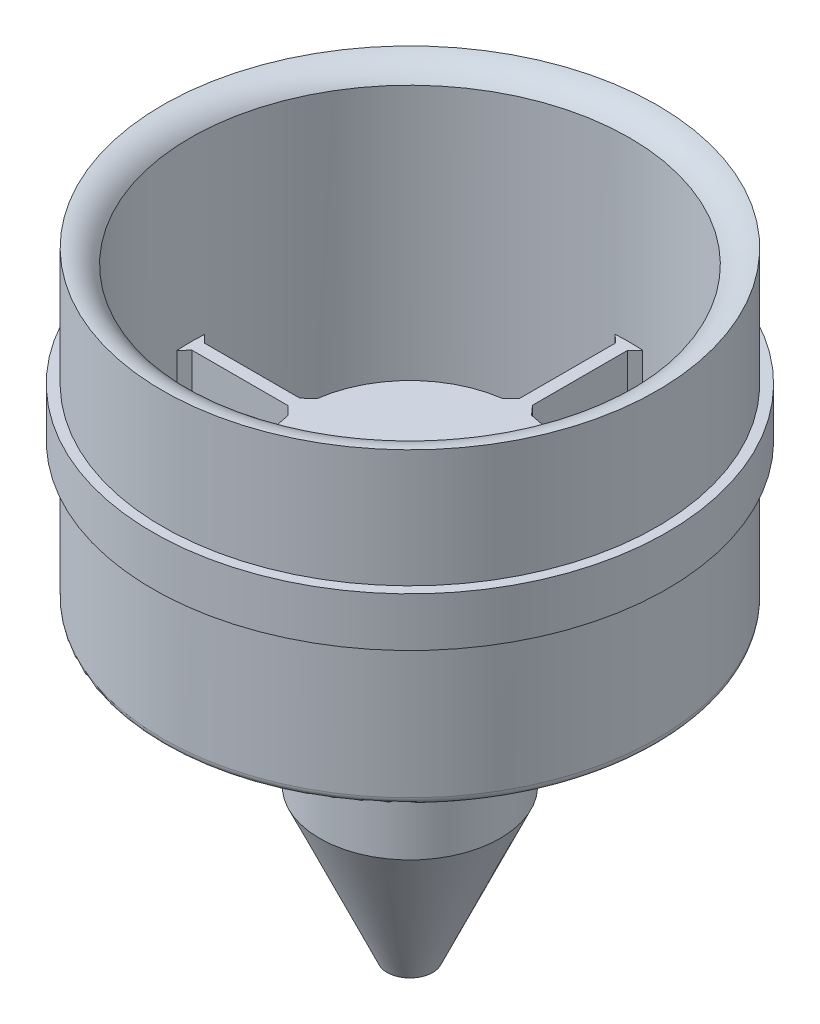
from build123d import *

# Parameters (mm, degrees)
SKETCH1_R           = 40
SKETCH1_R_2         = 35.5
BOSS_EXTRUDE1_DEPTH = 50
BOSS_EXTRUDE2_DEPTH = 19.05
SKETCH4_R           = 3.175
CUT_EXTRUDE1_DEPTH  = 6.35
CHAMFER1_SIZE       = 1.27
CHAMFER1_SIZE2      = 2.532115863
CHAMFER2_SIZE       = 1.27
CHAMFER2_SIZE_2     = 1.349308072
CHAMFER2_SIZE_3     = 1.235682395
CHAMFER3_SIZE       = 1.27
FILLET1_R           = 1.27
SKETCH9_W           = 1.5875
SKETCH9_H           = 7.9375


with BuildPart() as part:
    # Sketch1 → Boss-Extrude1 (new body)
    with BuildSketch(Plane(origin=(0, 0, 0), x_dir=(1, 0, 0), z_dir=(0, 1, 0))):
        with Locations(Location((0, 0, 0), (0, 0, 270))):
            Circle(SKETCH1_R)
        with Locations(Location((0, 0, 0), (0, 0, 270))):
            Circle(SKETCH1_R_2, mode=Mode.SUBTRACT)
    extrude(amount=BOSS_EXTRUDE1_DEPTH)

    # Sketch3 → Boss-Extrude2 (add)
    with BuildSketch(Plane.XZ):
        with BuildLine():
            Line((17.47140521, -1), (1, -1))
            Line((1, -1), (1, -17.47140521))
            ThreePointArc((1, -17.47140521), (12.374368671, -12.374368671), (17.47140521, -1))
        make_face()
        with BuildLine():
            Line((1, 17.47140521), (1, 1))
            Line((1, 1), (17.47140521, 1))
            ThreePointArc((17.47140521, 1), (12.374368671, 12.374368671), (1, 17.47140521))
        make_face()
        with BuildLine():
            Line((-17.47140521, 1), (-1, 1))
            Line((-1, 1), (-1, 17.47140521))
            ThreePointArc((-1, 17.47140521), (-12.374368671, 12.374368671), (-17.47140521, 1))
        make_face()
        with BuildLine():
            Line((-1, -17.47140521), (-1, -1))
            Line((-1, -1), (-17.47140521, -1))
            ThreePointArc((-17.47140521, -1), (-12.374368671, -12.374368671), (-1, -17.47140521))
        make_face()
        with BuildLine():
            ThreePointArc((0, -1), (0.707106781, -0.707106781), (1, 0))
            ThreePointArc((1, 0), (0.707106781, 0.707106781), (0, 1))
            ThreePointArc((0, 1), (-0.707106781, 0.707106781), (-1, 0))
            ThreePointArc((-1, 0), (-0.707106781, -0.707106781), (0, -1))
        make_face()
        with BuildLine():
            Line((-1, -1), (0, -1))
            ThreePointArc((0, -1), (-0.707106781, -0.707106781), (-1, 0))
            Line((-1, 0), (-1, -1))
        make_face()
        with BuildLine():
            Line((1, -1), (1, 0))
            ThreePointArc((1, 0), (0.707106781, -0.707106781), (0, -1))
            Line((0, -1), (1, -1))
        make_face()
        with BuildLine():
            ThreePointArc((0, 1), (0.707106781, 0.707106781), (1, 0))
            Line((1, 0), (1, 1))
            Line((1, 1), (0, 1))
        make_face()
        with BuildLine():
            ThreePointArc((-1, 0), (-0.707106781, 0.707106781), (0, 1))
            Line((0, 1), (-1, 1))
            Line((-1, 1), (-1, 0))
        make_face()
        with BuildLine():
            Line((-17.47140521, -1), (-1, -1))
            Line((-1, -1), (-1, 0))
            Line((-1, 0), (-1, 1))
            Line((-1, 1), (-17.47140521, 1))
            ThreePointArc((-17.47140521, 1), (-17.5, 0), (-17.47140521, -1))
        make_face()
        with BuildLine():
            Line((1, 1), (1, 0))
            Line((1, 0), (1, -1))
            Line((1, -1), (17.47140521, -1))
            ThreePointArc((17.47140521, -1), (17.492849842, -0.500204374), (17.5, 0))
            ThreePointArc((17.5, 0), (17.492849842, 0.500204374), (17.47140521, 1))
            Line((17.47140521, 1), (1, 1))
        make_face()
        with BuildLine():
            Line((0, 1), (1, 1))
            Line((1, 1), (1, 17.47140521))
            ThreePointArc((1, 17.47140521), (0, 17.5), (-1, 17.47140521))
            Line((-1, 17.47140521), (-1, 1))
            Line((-1, 1), (0, 1))
        make_face()
        with BuildLine():
            Line((1, -17.47140521), (1, -1))
            Line((1, -1), (0, -1))
            Line((0, -1), (-1, -1))
            Line((-1, -1), (-1, -17.47140521))
            ThreePointArc((-1, -17.47140521), (0, -17.5), (1, -17.47140521))
        make_face()
        with BuildLine():
            ThreePointArc((-1, 17.47140521), (0, 17.5), (1, 17.47140521))
            Line((1, 17.47140521), (1, 35.485912698))
            ThreePointArc((1, 35.485912698), (0, 35.5), (-1, 35.485912698))
            Line((-1, 35.485912698), (-1, 17.47140521))
        make_face()
        with BuildLine():
            Line((-35.485912698, -1), (-17.47140521, -1))
            ThreePointArc((-17.47140521, -1), (-17.5, 0), (-17.47140521, 1))
            Line((-17.47140521, 1), (-35.485912698, 1))
            ThreePointArc((-35.485912698, 1), (-35.5, 0), (-35.485912698, -1))
        make_face()
        with BuildLine():
            Line((35.485912698, 1), (17.47140521, 1))
            ThreePointArc((17.47140521, 1), (17.492849842, 0.500204374), (17.5, 0))
            ThreePointArc((17.5, 0), (17.492849842, -0.500204374), (17.47140521, -1))
            Line((17.47140521, -1), (35.485912698, -1))
            ThreePointArc((35.485912698, -1), (35.496478, -0.500049611), (35.5, 0))
            ThreePointArc((35.5, 0), (35.496478, 0.500049611), (35.485912698, 1))
        make_face()
        with BuildLine():
            Line((1, -35.485912698), (1, -17.47140521))
            ThreePointArc((1, -17.47140521), (0, -17.5), (-1, -17.47140521))
            Line((-1, -17.47140521), (-1, -35.485912698))
            ThreePointArc((-1, -35.485912698), (0, -35.5), (1, -35.485912698))
        make_face()
    extrude(amount=-BOSS_EXTRUDE2_DEPTH)

    # Sketch4 → Cut-Extrude1 (cut)
    with BuildSketch(Plane(origin=(0, 19.05, 0), x_dir=(1, 0, 0), z_dir=(0, 1, 0))):
        with Locations(Location((0, 0, 0), (0, 0, 270))):
            Circle(SKETCH4_R)
    extrude(amount=-CUT_EXTRUDE1_DEPTH, mode=Mode.SUBTRACT)

    # Sketch6 → Cut-Revolve1 (revolve, cut)
    with BuildSketch(Plane(origin=(0, 0, 0), x_dir=(0, 0, -1), z_dir=(1, 0, 0)), mode=Mode.PRIVATE) as cut_revolve1_sk:
        with BuildLine():
            Line((-34.613579945, 45.698422217), (0, 45.698422217))
            Line((0, 45.698422217), (0, 50))
            Line((0, 50), (-40, 50))
            ThreePointArc((-40, 50), (-36.55336786, 48.792643537), (-34.613579945, 45.698422217))
        make_face()
    revolve(cut_revolve1_sk.sketch.rotate(Axis((0, 0, 0), (0, 1, 0)), 180), axis=Axis((0, 0, 0), (0, 1, 0)), mode=Mode.SUBTRACT)

    # Sketch8 → Revolve1 (revolve)
    with BuildSketch(Plane(origin=(0, 0, 0), x_dir=(0, 0, -1), z_dir=(1, 0, 0))):
        Polygon((0, 0), (-14.605, 0), (-14.605, -25.4), (-3.175, -50.8), (0, -50.8), align=None)
    revolve(axis=Axis((0, -50.8, 0), (0, 1, 0)))

    # Chamfer1
    chamfer1_edges = [part.edges().sort_by_distance(p)[0] for p in [
        (0, -50.8, -3.175),
    ]]
    chamfer1_side = [part.faces().sort_by_distance(p)[0] for p in [
        (0, -38.1, -8.89),
    ]]
    chamfer(chamfer1_edges, length=CHAMFER1_SIZE, length2=CHAMFER1_SIZE2, reference=chamfer1_side[0])

    # Chamfer2
    # the kernel refuses this chamfer: 1.349308072, 1.27, 1.235682395 mm, written as the material it adds along each edge
    with BuildSketch(Plane(origin=(1, 0, 17.47140521), x_dir=(0, 0, 1), z_dir=(0, 1, 0)), Plane(origin=(17.47140521, 0, -1), x_dir=(1, 0, 0), z_dir=(0, 1, 0)), Plane(origin=(-1, 0, -17.47140521), x_dir=(0, 0, -1), z_dir=(0, 1, 0)), Plane(origin=(-17.47140521, 0, 1), x_dir=(-1, 0, 0), z_dir=(0, 1, 0))) as chamfer2_piece_1:
        with BuildLine():
            Line((CHAMFER2_SIZE, 0), (-0.137845907, 1.407845907))
            ThreePointArc((-0.137845907, 1.407845907), (-0.05673998, 0.726103978), (0, 0))
            Line((0, 0), (CHAMFER2_SIZE, 0))
        make_face()
    extrude(amount=19.05)
    with BuildSketch(Plane(origin=(17.47140521, 0, 1), x_dir=(1, 0, 0), z_dir=(0, 1, 0)), Plane(origin=(1, 0, -17.47140521), x_dir=(0, 0, -1), z_dir=(0, 1, 0)), Plane(origin=(-17.47140521, 0, -1), x_dir=(-1, 0, 0), z_dir=(0, 1, 0)), Plane(origin=(-1, 0, 17.47140521), x_dir=(0, 0, 1), z_dir=(0, 1, 0))) as chamfer2_piece_2:
        with BuildLine():
            Line((CHAMFER2_SIZE_2, 0), (-0.125180008, -1.314837196))
            ThreePointArc((-0.125180008, -1.314837196), (-0.052071189, -0.67833318), (0, 0))
            Line((0, 0), (CHAMFER2_SIZE_2, 0))
        make_face()
    extrude(amount=19.05)
    with BuildSketch(Plane(origin=(35.485912698, 0, 1), x_dir=(-0.04528724954779088, 0, 0.9989740061825413), z_dir=(0, 1, 0)), Plane(origin=(1, 0, -35.485912698), x_dir=(0.9989740061825413, 0, 0.045287249547790925), z_dir=(0, 1, 0)), Plane(origin=(-35.485912698, 0, -1), x_dir=(0.04528724954779079, 0, -0.9989740061825413), z_dir=(0, 1, 0)), Plane(origin=(-1, 0, 35.485912698), x_dir=(-0.998974006182541, 0, -0.04528724954779687), z_dir=(0, 1, 0))) as chamfer2_piece_3:
        with BuildLine():
            Line((1.216170755, 0), (CHAMFER2_SIZE * 0.0452872495476, -CHAMFER2_SIZE * 0.998974006183))
            Line((CHAMFER2_SIZE * 0.0452872495476, -CHAMFER2_SIZE * 0.998974006183), (0, 0))
            ThreePointArc((0, 0), (0.625207544, 0.00520425), (1.216170755, 0))
        make_face()
    extrude(amount=19.05)
    with BuildSketch(Plane(origin=(35.485912698, 0, -1), x_dir=(-0.04573863515170876, 0, -0.9989534409843429), z_dir=(0, 1, 0)), Plane(origin=(-1, 0, -35.485912698), x_dir=(-0.9989534409843427, 0, 0.045738635151709006), z_dir=(0, 1, 0)), Plane(origin=(-35.485912698, 0, 1), x_dir=(0.04573863515170318, 0, 0.998953440984343), z_dir=(0, 1, 0)), Plane(origin=(1, 0, 35.485912698), x_dir=(0.998953440984343, 0, -0.045738635151703046), z_dir=(0, 1, 0))) as chamfer2_piece_4:
        with BuildLine():
            Line((1.248247546, 0), (CHAMFER2_SIZE_3 * 0.0457386351654, CHAMFER2_SIZE_3 * 0.998953441289))
            Line((CHAMFER2_SIZE_3 * 0.0457386351654, CHAMFER2_SIZE_3 * 0.998953441289), (0, 0))
            ThreePointArc((0, 0), (0.641759392, -0.005482388), (1.248247546, 0))
        make_face()
    extrude(amount=19.05)

    # Chamfer3
    chamfer3_edges = [part.edges().sort_by_distance(p)[0] for p in [
        (12.341137112, 0, -12.407511224),
        (-12.407511224, 0, -12.341137112),
        (-12.341137112, 0, 12.407511224),
        (12.407511224, 0, 12.341137112),
    ]]
    chamfer(chamfer3_edges, length=CHAMFER3_SIZE)

    # Fillet1
    # the kernel refuses this fillet: 1.27 mm, written as the material it adds along each edge
    with BuildSketch(Plane(origin=(0, 0, 0), x_dir=(0, 0, 1), z_dir=(-1, 0, 0))) as fillet1_piece_1:
        with BuildLine():
            CenterArc((14.605 + FILLET1_R, -FILLET1_R), FILLET1_R, 90, 90)
            Line((14.605, -FILLET1_R), (14.605, 0))
            Line((14.605, 0), (14.605 + FILLET1_R, 0))
        make_face()
    revolve(axis=Axis((0, 0, 0), (0, 1, 0)))
    # the kernel refuses this fillet: 1.27 mm, written as the material it takes off along each edge
    with BuildSketch(Plane(origin=(0, 0, 0), x_dir=(0, 0, 1), z_dir=(-1, 0, 0))) as fillet1_2_piece_1:
        with BuildLine():
            CenterArc((40 - FILLET1_R, FILLET1_R), FILLET1_R, 270, 90)
            Line((40, FILLET1_R), (40, 0))
            Line((40, 0), (40 - FILLET1_R, 0))
        make_face()
    revolve(axis=Axis((0, 0, 0), (0, 1, 0)), mode=Mode.SUBTRACT)
    with BuildSketch(Plane(origin=(0, 0, 0), x_dir=(-0.026127594293691846, 0, 0.9996586161367412), z_dir=(-0.9996586161367412, 0, -0.026127594293691846))) as fillet1_2_piece_2_section:
        with BuildLine():
            CenterArc((35.5 + FILLET1_R, FILLET1_R), FILLET1_R, 180, 90)
            Line((35.5, FILLET1_R), (35.5, 0))
            Line((35.5, 0), (35.5 + FILLET1_R, 0))
        make_face()
    fillet1_2_piece_2 = revolve(axis=Axis((0, 0, 0), (0, 1, 0)), revolution_arc=93.046121148, mode=Mode.PRIVATE)
    fillet1_2_piece_2 = split(fillet1_2_piece_2, bisect_by=Plane(origin=(-16.626095657, 0, 17.590321009), z_dir=(0.6869076823676358, 0, -0.7267446841252595)), keep=Keep.TOP, mode=Mode.PRIVATE)
    fillet1_2_piece_2 = split(fillet1_2_piece_2, bisect_by=Plane(origin=(16.607956349, 0, -16.607956349), z_dir=(-0.707106781186694, 0, 0.707106781186401)), keep=Keep.TOP, mode=Mode.PRIVATE)
    add(fillet1_2_piece_2, mode=Mode.SUBTRACT)
    with BuildSketch(Plane(origin=(0, 0, 0), x_dir=(-0.999658616136741, 0, -0.02612759429369253), z_dir=(0.02612759429369253, 0, -0.999658616136741))) as fillet1_2_piece_3_section:
        with BuildLine():
            CenterArc((35.5 + FILLET1_R, FILLET1_R), FILLET1_R, 180, 90)
            Line((35.5, FILLET1_R), (35.5, 0))
            Line((35.5, 0), (35.5 + FILLET1_R, 0))
        make_face()
    fillet1_2_piece_3 = revolve(axis=Axis((0, 0, 0), (0, 1, 0)), revolution_arc=93.046121148, mode=Mode.PRIVATE)
    fillet1_2_piece_3 = split(fillet1_2_piece_3, bisect_by=Plane(origin=(16.607956349, 0, 16.607956349), z_dir=(-0.7071067811864397, 0, -0.7071067811866554)), keep=Keep.TOP, mode=Mode.PRIVATE)
    fillet1_2_piece_3 = split(fillet1_2_piece_3, bisect_by=Plane(origin=(-17.590321009, 0, -16.626095657), z_dir=(0.7267446841252595, 0, 0.6869076823676358)), keep=Keep.TOP, mode=Mode.PRIVATE)
    add(fillet1_2_piece_3, mode=Mode.SUBTRACT)
    with BuildSketch(Plane(origin=(0, 0, 0), x_dir=(0.026127594293692467, 0, -0.999658616136741), z_dir=(0.999658616136741, 0, 0.026127594293692467))) as fillet1_2_piece_4_section:
        with BuildLine():
            CenterArc((35.5 + FILLET1_R, FILLET1_R), FILLET1_R, 180, 90)
            Line((35.5, FILLET1_R), (35.5, 0))
            Line((35.5, 0), (35.5 + FILLET1_R, 0))
        make_face()
    fillet1_2_piece_4 = revolve(axis=Axis((0, 0, 0), (0, 1, 0)), revolution_arc=93.046121148, mode=Mode.PRIVATE)
    fillet1_2_piece_4 = split(fillet1_2_piece_4, bisect_by=Plane(origin=(16.626095657, 0, -17.590321009), z_dir=(-0.6869076823676358, 0, 0.7267446841252595)), keep=Keep.TOP, mode=Mode.PRIVATE)
    fillet1_2_piece_4 = split(fillet1_2_piece_4, bisect_by=Plane(origin=(-16.607956349, 0, 16.607956349), z_dir=(0.707106781186694, 0, -0.707106781186401)), keep=Keep.TOP, mode=Mode.PRIVATE)
    add(fillet1_2_piece_4, mode=Mode.SUBTRACT)
    with BuildSketch(Plane(origin=(0, 0, 0), x_dir=(0.9996586161367412, 0, 0.026127594293692404), z_dir=(-0.026127594293692404, 0, 0.9996586161367412))) as fillet1_2_piece_5_section:
        with BuildLine():
            CenterArc((35.5 + FILLET1_R, FILLET1_R), FILLET1_R, 180, 90)
            Line((35.5, FILLET1_R), (35.5, 0))
            Line((35.5, 0), (35.5 + FILLET1_R, 0))
        make_face()
    fillet1_2_piece_5 = revolve(axis=Axis((0, 0, 0), (0, 1, 0)), revolution_arc=93.046121148, mode=Mode.PRIVATE)
    fillet1_2_piece_5 = split(fillet1_2_piece_5, bisect_by=Plane(origin=(-16.607956349, 0, -16.607956349), z_dir=(0.707106781186401, 0, 0.707106781186694)), keep=Keep.TOP, mode=Mode.PRIVATE)
    fillet1_2_piece_5 = split(fillet1_2_piece_5, bisect_by=Plane(origin=(17.590321009, 0, 16.626095657), z_dir=(-0.7267446841252595, 0, -0.6869076823676358)), keep=Keep.TOP, mode=Mode.PRIVATE)
    add(fillet1_2_piece_5, mode=Mode.SUBTRACT)

    # Sketch9 → Revolve2 (revolve)
    with BuildSketch(Plane(origin=(0, 0, 0), x_dir=(0, 0, -1), z_dir=(1, 0, 0)), mode=Mode.PRIVATE) as revolve2_sk:
        with Locations((-40.79375, 26.98125)):
            Rectangle(SKETCH9_W, SKETCH9_H)
    revolve(revolve2_sk.sketch.rotate(Axis((0, 0, 0), (0, 1, 0)), 180), axis=Axis((0, 0, 0), (0, 1, 0)))


solid = part.part
